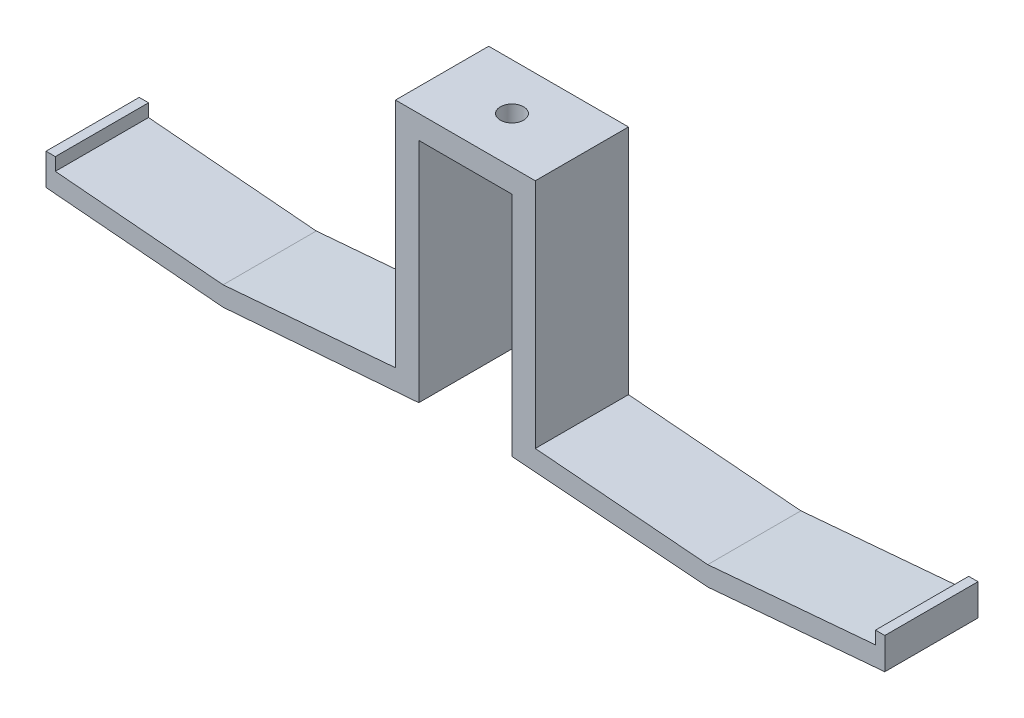
from build123d import *

# Parameters (mm, degrees)
BOSS_EXTRUDE1_DEPTH = 25.4
CUT_EXTRUDE1_REACH  = 139.665
SKETCH3_R           = 3.175


with BuildPart() as part:
    # Sketch2 → Boss-Extrude1 (new body)
    with BuildSketch(Plane.XY):
        Polygon((12.7, 0), (12.7, -61.9179737), (66.04, -66.051353419), (114.3, -61.9179737), (114.3, -53.351353419), (111.76, -53.351353419), (111.76, -56.8379737), (66.04, -60.753807118), (19.05, -56.8379737), (19.05, 6.35), (-19.05, 6.35), (-19.05, -56.8379737), (-66.04, -60.753807118), (-111.76, -56.8379737), (-111.76, -53.351353419), (-114.3, -53.351353419), (-114.3, -61.9179737), (-66.04, -66.051353419), (-12.7, -61.9179737), (-12.7, 0), align=None)
    extrude(amount=BOSS_EXTRUDE1_DEPTH)

    # Sketch3 → Cut-Extrude1 (cut, up to next)
    with BuildSketch(Plane(origin=(0, 6.35, 0), x_dir=(1, 0, 0), z_dir=(0, 1, 0)), mode=Mode.PRIVATE) as cut_extrude1_sk1:
        with Locations((0, -12.7)):
            Circle(SKETCH3_R)
    cut_extrude1_tool1 = extrude(cut_extrude1_sk1.sketch, amount=-CUT_EXTRUDE1_REACH, mode=Mode.PRIVATE) & part.part
    add(cut_extrude1_tool1.solids().sort_by_distance((0, 6.35, 12.7))[0], mode=Mode.SUBTRACT)


solid = part.part
